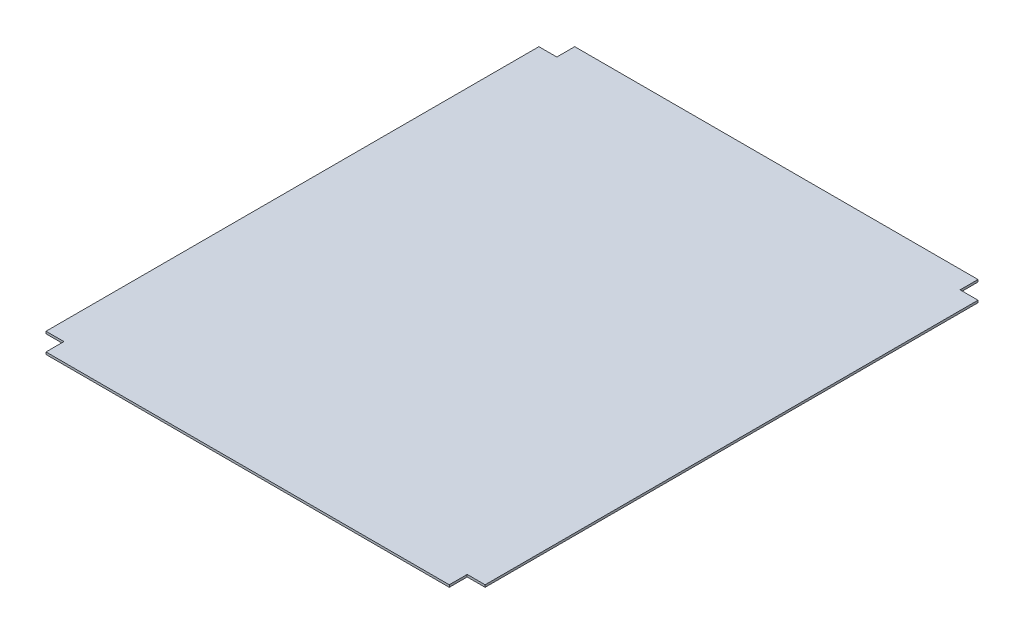
from build123d import *

# Parameters (mm, degrees)
SKETCH1_W           = 1244.6
SKETCH1_H           = 1498.6
BOSS_EXTRUDE1_DEPTH = 3.175
SKETCH2_W           = 50.8
SKETCH2_H           = 50.8
CUT_EXTRUDE1_DEPTH  = 975.0370129


with BuildPart() as part:
    # Sketch1 → Boss-Extrude1 (new, symmetric)
    with BuildSketch(Plane(origin=(0, 0, 0), x_dir=(1, 0, 0), z_dir=(0, 1, 0))):
        Rectangle(SKETCH1_W, SKETCH1_H)
    extrude(amount=BOSS_EXTRUDE1_DEPTH, both=True)

    # Sketch2 → Cut-Extrude1 (cut, through all)
    with BuildSketch(Plane(origin=(0, 3.175, 0), x_dir=(1, 0, 0), z_dir=(0, 1, 0))):
        with Locations((-596.9, 723.9)):
            Rectangle(SKETCH2_W, SKETCH2_H)
        with Locations((596.9, 723.9)):
            Rectangle(SKETCH2_W, SKETCH2_H)
        with Locations((596.9, -723.9)):
            Rectangle(SKETCH2_W, SKETCH2_H)
        with Locations((-596.9, -723.9)):
            Rectangle(SKETCH2_W, SKETCH2_H)
    extrude(amount=-CUT_EXTRUDE1_DEPTH, mode=Mode.SUBTRACT)


solid = part.part
